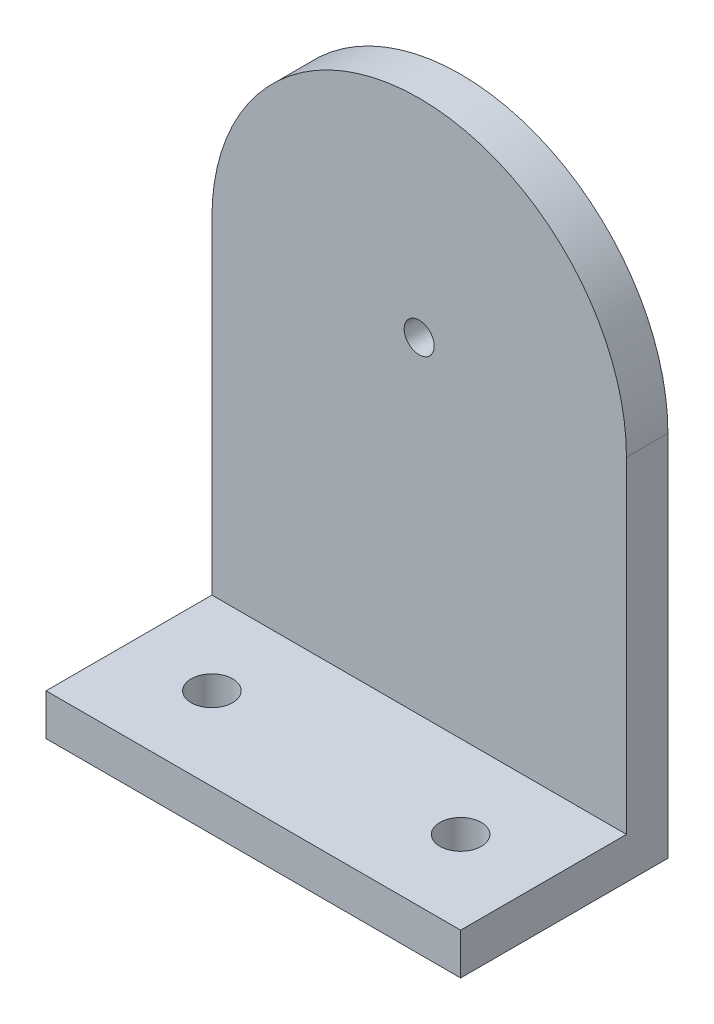
from build123d import *

# Parameters (mm, degrees)
SKETCH1_R           = 15.875
SKETCH1_W           = 31.75
SKETCH1_H           = 28.194
BOSS_EXTRUDE1_DEPTH = 3.175
SKETCH4_W           = 31.75
SKETCH4_H           = 3.175
BOSS_EXTRUDE2_DEPTH = 12.7
SKETCH5_R           = 1.5875
CUT_EXTRUDE2_DEPTH  = 47.651371748
SKETCH6_R           = 1.15
CUT_EXTRUDE3_DEPTH  = 35.759275899


with BuildPart() as part:
    # Sketch1 → Boss-Extrude1 (new body)
    with BuildSketch(Plane.XY):
        Circle(SKETCH1_R)
        with Locations((0, -14.097)):
            Rectangle(SKETCH1_W, SKETCH1_H)
    extrude(amount=BOSS_EXTRUDE1_DEPTH)

    # Sketch4 → Boss-Extrude2 (add)
    with BuildSketch(Plane.XY.offset(3.175)):
        with Locations((0, -26.6065)):
            Rectangle(SKETCH4_W, SKETCH4_H)
    extrude(amount=BOSS_EXTRUDE2_DEPTH)

    # Sketch5 → Cut-Extrude2 (cut, through all)
    with BuildSketch(Plane(origin=(0, -25.019, 0), x_dir=(1, 0, 0), z_dir=(0, 1, 0))):
        with Locations((-9.525, -9.525)):
            Circle(SKETCH5_R)
        with Locations((9.525, -9.525)):
            Circle(SKETCH5_R)
    extrude(amount=-CUT_EXTRUDE2_DEPTH, mode=Mode.SUBTRACT)

    # Sketch6 → Cut-Extrude3 (cut, through all)
    with BuildSketch(Plane.XY.offset(3.175)):
        Circle(SKETCH6_R)
    extrude(amount=-CUT_EXTRUDE3_DEPTH, mode=Mode.SUBTRACT)


solid = part.part
